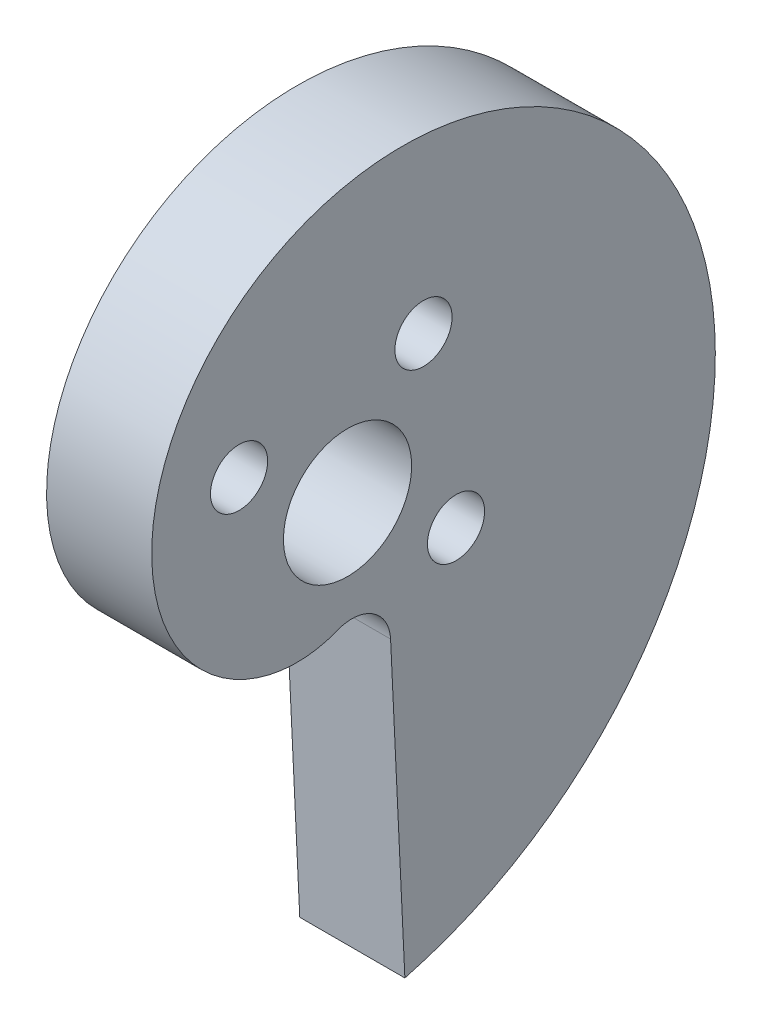
from build123d import *

# Parameters (mm, degrees)
SKETCH4_R              = 3
BOSS_EXTRUDE1_DEPTH    = 6.35
MOVE_FACE1_OUTLINE_R   = 3
MOVE_FACE1_OUTLINE_R_2 = 2.7841
MOVE_FACE1_DEPTH       = 6.35
SKETCH11_R             = 1.7272
SKETCH11_R_2           = 3.873
CUT_EXTRUDE2_DEPTH     = 36.237722546


# Read off the part's stored shape, not the designer's step: Move Face1
with BuildPart() as part:
    # Sketch4 → Boss-Extrude1 (new body)
    with BuildSketch(Plane(origin=(0, 0, 0), x_dir=(0, 0, -1), z_dir=(1, 0, 0))):
        with BuildLine():
            Line((3.667013126, -26.3254835), (2.816473307, -8.431236894))
            ThreePointArc((2.816473307, -8.431236894), (1.639602622, -6.396649217), (-0.700777066, -6.179406175))
            add(Edge.make_bspline(
                [(-0.700777066, -6.179406175), (-1.525102008, -6.512822326), (-2.494871997, -6.679047096), (-4.555429578, -6.54165034), (-5.644996058, -6.237076936), (-7.717261628, -5.106975392), (-8.698405735, -4.281093265), (-10.311829803, -2.164612563), (-10.942499326, -0.874358563), (-11.647480976, 2.006859472), (-11.720427957, 3.596803483), (-11.182779689, 6.826310345), (-10.571334953, 8.46432492), (-9.132019695, 10.73433891), (-8.566197708, 11.459621106), (-7.273120414, 12.810057002), (-6.545872807, 13.435152517), (-4.948692799, 14.549748502), (-4.078780417, 15.039192621), (-2.22269385, 15.85074605), (-1.236551533, 16.172803424), (0.818678144, 16.623204755), (1.887722789, 16.751503646), (4.069669804, 16.79483508), (5.182520117, 16.709831654), (7.408648574, 16.315055224), (8.521867273, 16.00525724), (10.70264063, 15.158359498), (11.770130786, 14.621247223), (13.812561896, 13.326727542), (14.787435905, 12.56932106), (16.598938448, 10.850935673), (17.435500393, 9.889971566), (18.927885533, 7.790674993), (19.583645356, 6.652371052), (20.677096627, 4.233429246), (21.114730733, 2.952832896), (21.741586229, 0.292117033), (21.930758945, -1.087949282), (22.038932986, -3.898444365), (21.957896657, -5.328810088), (21.513783431, -8.186144708), (21.150681858, -9.613043017), (20.141400668, -12.407098951), (19.49521083, -13.774181132), (17.930076055, -16.391877744), (17.011136269, -17.642414844), (14.922264044, -19.972214517), (13.752352434, -21.051401006), (11.194349378, -22.98792657), (9.80629411, -23.845193985), (6.855009859, -25.29377098), (5.291831431, -25.88501641), (3.667013126, -26.3254835)],
                knots=[0, 0, 0, 0, 0.0625, 0.0625, 0.125, 0.125, 0.1875, 0.1875, 0.25, 0.25, 0.3125, 0.3125, 0.375, 0.375, 0.40625, 0.40625, 0.4375, 0.4375, 0.46875, 0.46875, 0.5, 0.5, 0.53125, 0.53125, 0.5625, 0.5625, 0.59375, 0.59375, 0.625, 0.625, 0.65625, 0.65625, 0.6875, 0.6875, 0.71875, 0.71875, 0.75, 0.75, 0.78125, 0.78125, 0.8125, 0.8125, 0.84375, 0.84375, 0.875, 0.875, 0.90625, 0.90625, 0.9375, 0.9375, 0.96875, 0.96875, 1, 1, 1, 1], degree=3))
        make_face()
        Circle(SKETCH4_R, mode=Mode.SUBTRACT)
    extrude(amount=BOSS_EXTRUDE1_DEPTH)

    # Move Face1 outline → Move Face1 (add)
    # profile 1 of 2: a face of its own
    with BuildSketch(Plane.YZ):
        with BuildLine():
            Line((-8.441487365, -2.600816779), (-26.604178645, -3.464116168))
            add(Edge.make_bspline(
                [(-26.604178645, -3.464116168), (-26.599569003, -3.481120458), (-26.594959362, -3.498124748), (-26.59034972, -3.515129038), (-26.585740078, -3.532133328), (-26.581130437, -3.549137618), (-26.576520795, -3.566141908), (-26.571911153, -3.583146198), (-26.567301512, -3.600150488), (-26.56269187, -3.617154778), (-26.558082228, -3.634159068), (-26.553472587, -3.651163358), (-26.548862945, -3.668167648), (-26.544253303, -3.685171938), (-26.53927128, -3.703549889), (-26.538898899, -3.704923549), (-26.538526517, -3.70629721), (-26.538154136, -3.707670871), (-26.537781754, -3.709044531), (-26.537409373, -3.710418192), (-26.537036991, -3.711791852), (-26.53666461, -3.713165513), (-26.536292228, -3.714539173), (-26.535919847, -3.715912834), (-26.535547465, -3.717286495), (-26.535175084, -3.718660155), (-26.534802702, -3.720033816), (-26.53424413, -3.722094307), (-26.534059907, -3.722773916), (-26.533858021, -3.723518442), (-26.533727067, -3.724001851), (-26.533440048, -3.725060798), (-26.533340537, -3.725426825), (-26.533133021, -3.726192717), (-26.532893488, -3.727076218), (-26.532782162, -3.727485594), (-26.532537582, -3.728388165), (-26.532375797, -3.728983938), (-26.532180677, -3.729703197), (-26.531993743, -3.730392017), (-26.531617908, -3.731776793), (-26.531429971, -3.732469173), (-26.531242014, -3.733161545), (-26.531054038, -3.733853909), (-26.530866042, -3.734546265), (-26.530678027, -3.735238614), (-26.530489992, -3.735930954), (-26.530301938, -3.736623286), (-26.530113864, -3.73731561), (-26.529925771, -3.738007927), (-26.529737659, -3.738700235), (-26.529549527, -3.739392535), (-26.529361375, -3.740084828), (-26.528420519, -3.74354625), (-26.527667523, -3.74631526), (-26.526914215, -3.749084142), (-26.526160594, -3.751852897), (-26.525406663, -3.754621524), (-26.524652417, -3.757390023), (-26.523897864, -3.760158394), (-26.523142994, -3.762926638), (-26.522387816, -3.765694753), (-26.521632324, -3.768462741), (-26.520876522, -3.7712306), (-26.520120408, -3.773998332), (-26.519363982, -3.776765936), (-26.517093769, -3.785068362), (-26.515579047, -3.790602801), (-26.514063078, -3.796136728), (-26.512545864, -3.801670141), (-26.511027403, -3.807203041), (-26.509507697, -3.812735429), (-26.507986745, -3.818267302), (-26.506464548, -3.823798661), (-26.504941106, -3.829329506), (-26.503416418, -3.834859837), (-26.501890486, -3.840389653), (-26.500363309, -3.845918954), (-26.498834888, -3.85144774), (-26.494245891, -3.868032549), (-26.491181583, -3.879087027), (-26.488112299, -3.890139439), (-26.485038042, -3.901189785), (-26.481958812, -3.912238061), (-26.478874612, -3.923284266), (-26.475785441, -3.934328398), (-26.472691304, -3.945370453), (-26.4695922, -3.956410431), (-26.466488131, -3.967448328), (-26.463379099, -3.978484142), (-26.460265106, -3.989517871), (-26.457146153, -4.000549514), (-26.441526593, -4.055697279), (-26.428951609, -4.099782062), (-26.416297387, -4.143833272), (-26.403564026, -4.187850766), (-26.390751622, -4.2318344), (-26.377860278, -4.275784033), (-26.364890086, -4.31969952), (-26.351841151, -4.363580717), (-26.338713566, -4.407427483), (-26.325507433, -4.451239673), (-26.312222848, -4.495017144), (-26.298859911, -4.538759754), (-26.285418719, -4.582467358), (-26.217821979, -4.800829638), (-26.162494118, -4.974957082), (-26.105922065, -5.148512984), (-26.048112096, -5.321488181), (-25.989070491, -5.49387351), (-25.928803524, -5.665659807), (-25.867317478, -5.836837911), (-25.804618624, -6.007398657), (-25.740713246, -6.177332884), (-25.675607616, -6.346631428), (-25.609308015, -6.515285126), (-25.541820718, -6.683284815), (-25.473152005, -6.850621333), (-25.263620445, -7.350613883), (-25.119234857, -7.681244245), (-24.970181526, -8.009184855), (-24.816563128, -8.334008567), (-24.658405438, -8.656540908), (-24.495574442, -8.975326705), (-24.328540305, -9.291435032), (-24.157090549, -9.604622916), (-23.981161893, -9.914157206), (-23.801250109, -10.220890306), (-23.616969066, -10.524098117), (-23.428657045, -10.824036045), (-23.23626742, -11.120542818), (-22.843508974, -11.706612059), (-22.643142176, -11.996174333), (-22.438808393, -12.282198027), (-22.230723583, -12.56460565), (-22.018648797, -12.843459923), (-21.802917467, -13.118447754), (-21.583605212, -13.389644606), (-21.360601243, -13.657176078), (-21.134077845, -13.920797741), (-20.904199437, -14.180403567), (-20.670850853, -14.43621903), (-20.434249131, -14.687936687), (-20.194399706, -14.935644556), (-19.70838235, -15.42287054), (-19.462215458, -15.662397811), (-19.212931723, -15.897766285), (-18.960728671, -16.128991264), (-18.70539447, -16.355994955), (-18.447304202, -16.578625492), (-18.186499944, -16.796967202), (-17.922857209, -17.011060359), (-17.656599224, -17.220738444), (-17.387896766, -17.42596103), (-17.116588056, -17.626860373), (-16.842954408, -17.82323191), (-16.566974945, -18.015139117), (-16.010532784, -18.389907039), (-15.730066911, -18.572777232), (-15.447424653, -18.751061226), (-15.162746667, -18.924851219), (-14.875916093, -19.093949929), (-14.587276398, -19.258367365), (-14.296840097, -19.418183126), (-14.004513923, -19.573354608), (-13.710535007, -19.723805382), (-13.415054471, -19.869556513), (-13.117916757, -20.010637113), (-12.819417073, -20.146961011), (-12.519527346, -20.278558541), (-11.917189037, -20.532242336), (-11.614733643, -20.65433651), (-11.311086848, -20.771622769), (-11.006314451, -20.884236095), (-10.700430715, -20.991914806), (-10.39369458, -21.094796517), (-10.086097937, -21.192946197), (-9.777608438, -21.286263743), (-9.468444303, -21.374756831), (-9.158720169, -21.458492374), (-8.848328151, -21.537414262), (-8.537533287, -21.611545146), (-8.226317575, -21.68088471), (-7.603260387, -21.809981168), (-7.291409675, -21.869743076), (-6.979352707, -21.924681004), (-6.667077965, -21.974937355), (-6.354741362, -22.020247701), (-6.042483137, -22.060828702), (-5.730286129, -22.096726163), (-5.418195248, -22.127815836), (-5.10638259, -22.154172495), (-4.794917194, -22.175889882), (-4.483768614, -22.19285834), (-4.173135796, -22.205184806), (-3.863025065, -22.212847752), (-3.244042, -22.218898546), (-2.935160635, -22.217283683), (-2.627009812, -22.211051294), (-2.319535889, -22.200221076), (-2.012978585, -22.184764162), (-1.707390049, -22.164745089), (-1.402745405, -22.140231054), (-1.099140461, -22.111224435), (-0.796711927, -22.077727229), (-0.495491172, -22.03980106), (-0.195495425, -21.997498698), (0.103120125, -21.950796576), (0.400341286, -21.899765548), (0.991819558, -21.789077387), (1.28608355, -21.729419077), (1.578768432, -21.665496674), (1.869917455, -21.597302553), (2.159298453, -21.524877058), (2.446882891, -21.44828864), (2.732707168, -21.367584679), (3.016672969, -21.282790594), (3.298648908, -21.193943649), (3.578623787, -21.101102717), (3.85659217, -21.004314712), (4.132391722, -20.903599993), (4.406031128, -20.799020335), (4.948821205, -20.582201458), (5.217977174, -20.469959264), (5.484813738, -20.353954278), (5.749350964, -20.234161295), (6.01138819, -20.110681465), (6.270917632, -19.983580155), (6.527976619, -19.852885482), (6.782472092, -19.718646938), (7.034289441, -19.580933449), (7.283432367, -19.43979613), (7.529901875, -19.295274808), (7.77354503, -19.147434253), (8.014385292, -18.996321733), (8.490309508, -18.687660003), (8.725396651, -18.530106846), (8.957555599, -18.369412167), (9.186776625, -18.205547192), (9.412909718, -18.038656901), (9.635962414, -17.868799381), (9.855964095, -17.695988596), (10.072835585, -17.520295455), (10.286488685, -17.341812823), (10.496935081, -17.160582706), (10.704177349, -16.976639307), (10.908088748, -16.790084702), (11.108697582, -16.60095136), (11.503188846, -16.217665056), (11.697072069, -16.023508272), (11.887567215, -15.826919792), (12.074634411, -15.627883555), (12.258185431, -15.42656542), (12.438237852, -15.223014525), (12.614807781, -15.017239038), (12.787836646, -14.809325702), (12.957268738, -14.599380603), (13.123118176, -14.387438261), (13.285386007, -14.173530705), (13.443983714, -13.9577844), (13.598936774, -13.740220791), (13.901469825, -13.301617581), (14.049048428, -13.080575457), (14.192938252, -12.85786673), (14.333075884, -12.633504041), (14.469436513, -12.407648424), (14.602043246, -12.180340569), (14.730898025, -11.951592848), (14.855967044, -11.721500116), (14.977228845, -11.490169384), (15.094696526, -11.257631481), (15.208368824, -11.023920803), (15.318201343, -10.789171515), (15.424212302, -10.553400689), (15.62854924, -10.079983096), (15.726872378, -9.842336108), (15.821368333, -9.603809457), (15.911963677, -9.364456828), (15.998688398, -9.124410274), (16.081568069, -8.883704025), (16.160594519, -8.642364015), (16.235759672, -8.400484565), (16.307073362, -8.15816166), (16.374546973, -7.915427103), (16.438178826, -7.672322007), (16.497967314, -7.428970727), (16.553923089, -7.185393613), (16.658169192, -6.697950384), (16.706458163, -6.454088263), (16.750931294, -6.210116308), (16.791551227, -5.966156004), (16.828352164, -5.722265003), (16.861371473, -5.478483856), (16.89061727, -5.234873215), (16.916091026, -4.991505669), (16.937812625, -4.748444975), (16.955811803, -4.505744551), (16.970101403, -4.263463823), (16.98068149, -4.021672476), (16.987586075, -3.780425869), (16.994060031, -3.299148156), (16.993631026, -3.059123221), (16.989555385, -2.819737011), (16.981828074, -2.581119041), (16.97049256, -2.343310945), (16.955590155, -2.106340667), (16.937140606, -1.870268338), (16.91516095, -1.635166239), (16.889682937, -1.401088709), (16.860744509, -1.168076804), (16.828369507, -0.936186685), (16.792572797, -0.705489655), (16.753396921, -0.476025059), (16.668327332, -0.019684131), (16.622436928, 0.207187985), (16.573210516, 0.43274012), (16.520676595, 0.656845924), (16.464882551, 0.879479604), (16.405870334, 1.100624284), (16.3436718, 1.320223268), (16.278319602, 1.538208936), (16.209854217, 1.754538123), (16.138317988, 1.969182142), (16.063745228, 2.182090339), (15.986166539, 2.393194111), (15.905627626, 2.602469813), (15.738694717, 3.017250287), (15.652304686, 3.222753348), (15.563011722, 3.426348397), (15.470874943, 3.627923175), (15.375941264, 3.827466031), (15.27825116, 4.024968988), (15.177848129, 4.22038201), (15.074779017, 4.413646484), (14.969089842, 4.604731213), (14.860824208, 4.793618869), (14.750025822, 4.980266585), (14.6367404, 5.164613119), (14.521012434, 5.346648599), (14.284759964, 5.705997611), (14.164238936, 5.88331198), (14.041346931, 6.058244698), (13.916166576, 6.230707349), (13.788741729, 6.400699169), (13.659110682, 6.568218603), (13.527326668, 6.733225876), (13.393447683, 6.895675454), (13.257522548, 7.055547765), (13.11959423, 7.212834846), (12.979713874, 7.367503996), (12.837939646, 7.519506253), (12.694312503, 7.668841812), (12.403459758, 7.962101433), (12.256236093, 8.106028416), (12.107245062, 8.247230378), (11.956582639, 8.385649016), (11.804288588, 8.521291455), (11.65039943, 8.654160681), (11.494975113, 8.78422985), (11.338080513, 8.911469301), (11.179764974, 9.035870418), (11.020069941, 9.157432821), (10.859051406, 9.276135657), (10.696775757, 9.391945779), (10.53327979, 9.504870215), (10.348041361, 9.62863484), (10.327440973, 9.642341074), (10.306822731, 9.656001739), (10.286186731, 9.669616814), (10.265532905, 9.683186339), (10.244861188, 9.696710349), (10.224171615, 9.710188832), (10.203464367, 9.723621723), (10.182739741, 9.737008906), (10.161998068, 9.750350261), (10.141239561, 9.763645725), (10.12046411, 9.776895389), (10.099671, 9.79009961), (10.058046161, 9.81641871), (10.037217098, 9.829531834), (10.016371494, 9.842598537), (9.995509453, 9.855618821), (9.974631077, 9.868592692), (9.953736471, 9.881520152), (9.932825737, 9.894401206), (9.911898978, 9.907235857), (9.890956298, 9.920024109), (9.869997801, 9.932765967), (9.849023589, 9.945461434), (9.828033765, 9.958110514), (9.807028434, 9.97071321), (9.743966224, 10.00838216), (9.701863133, 10.033309276), (9.659699249, 10.058050905), (9.617475395, 10.082607077), (9.575192397, 10.106977826), (9.532851077, 10.131163181), (9.490452261, 10.155163174), (9.447996771, 10.178977836), (9.405485434, 10.202607198), (9.362919072, 10.226051291), (9.320298511, 10.249310147), (9.277624573, 10.272383796), (9.234898083, 10.29527227), (9.106563432, 10.363382261), (9.020800116, 10.408048353), (8.934836483, 10.451974125), (8.848679096, 10.495159823), (8.762334519, 10.537605698), (8.675809318, 10.579311995), (8.589110055, 10.620278965), (8.502243296, 10.660506853), (8.415215603, 10.699995909), (8.328033542, 10.73874638), (8.240703676, 10.776758515), (8.15323257, 10.814032561), (8.065626787, 10.850568766), (7.802425101, 10.957964605), (7.626444742, 11.026611369), (7.450004147, 11.092309662), (7.27315561, 11.155061426), (7.095951384, 11.214868552), (6.918443686, 11.271732888), (6.740684687, 11.325656229), (6.562726523, 11.376640328), (6.384621288, 11.424686885), (6.206421038, 11.469797554), (6.028177787, 11.511973941), (5.84994351, 11.551217606), (5.671770144, 11.587530057), (5.315649022, 11.654295458), (5.137728602, 11.684747226), (4.959700016, 11.712299475), (4.783019884, 11.736712222), (4.604276011, 11.758891306), (4.429464411, 11.777036031), (4.250811556, 11.793890793), (4.076436597, 11.806370641), (3.899761626, 11.817263639), (3.725133165, 11.824666119), (3.550410334, 11.829638498), (3.37648165, 11.831780195), (3.203155326, 11.831236863), (2.857881444, 11.824777298), (2.685930065, 11.818863209), (2.51470827, 11.810286856), (2.344260063, 11.799070213), (2.174629427, 11.785235191), (2.005860324, 11.768803637), (1.837996698, 11.749797331), (1.671082472, 11.728237989), (1.50516155, 11.704147262), (1.340277816, 11.677546737), (1.176475132, 11.648457935), (1.013797343, 11.616902313), (0.852288272, 11.582901263), (0.61184345, 11.528263534), (0.53200571, 11.509447542), (0.452431498, 11.490014724), (0.373262519, 11.470000825), (0.294382178, 11.449393041), (0.215797381, 11.428191413), (0.137577788, 11.406409742), (0.059709652, 11.384053465), (-0.017850954, 11.361120913), (-0.095072103, 11.33761765), (-0.171912733, 11.313553202), (-0.248433789, 11.288926884), (-0.324588602, 11.263745774), (-0.476187787, 11.21228181), (-0.551629997, 11.185999058), (-0.626711201, 11.159170067), (-0.701427774, 11.131799368), (-0.775776089, 11.103891494), (-0.849752523, 11.075450975), (-0.92335345, 11.046482344), (-0.996575245, 11.016990131), (-1.069414282, 10.986978867), (-1.141866938, 10.956453085), (-1.213929586, 10.925417316), (-1.285598602, 10.89387609), (-1.35687036, 10.86183394), (-1.569482988, 10.764218312), (-1.709621229, 10.697155476), (-1.848127108, 10.628143005), (-1.98497177, 10.557216936), (-2.120126347, 10.484413233), (-2.253561967, 10.409767786), (-2.385249746, 10.333316406), (-2.515160795, 10.255094835), (-2.643266216, 10.175138734), (-2.769537102, 10.093483694), (-2.893944539, 10.010165228), (-3.016459604, 9.925218776), (-3.137053367, 9.838679702), (-3.315018649, 9.706535092), (-3.373849905, 9.662101445), (-3.432225085, 9.617246491), (-3.489973308, 9.572127532), (-3.547384771, 9.52651408), (-3.604222119, 9.480589049), (-3.660493818, 9.43435795), (-3.716362737, 9.387700649), (-3.771715305, 9.340702599), (-3.826473613, 9.293429538), (-3.880830859, 9.245743042), (-3.934616774, 9.197770987), (-3.987913252, 9.149459099), (-4.093478067, 9.052199488), (-4.145749357, 9.003249721), (-4.19750826, 8.953985292), (-4.248753506, 8.904411497), (-4.299483825, 8.854533635), (-4.349697947, 8.804357003), (-4.399394603, 8.753886901), (-4.448572522, 8.703128624), (-4.497230434, 8.652087473), (-4.545367069, 8.600768744), (-4.592981158, 8.549177736), (-4.640071431, 8.497319746), (-4.686636617, 8.445200073), (-4.824753105, 8.288071896), (-4.914725275, 8.182294046), (-5.002581891, 8.075532644), (-5.088312844, 7.967829797), (-5.171907984, 7.859227538), (-5.253357116, 7.749767825), (-5.332650002, 7.639492543), (-5.409776362, 7.528443501), (-5.48472587, 7.416662437), (-5.55748816, 7.304191013), (-5.628052821, 7.191070818), (-5.696409398, 7.077343365), (-5.762547394, 6.963050096), (-5.890365144, 6.733414655), (-5.952053709, 6.61804774), (-6.011379226, 6.5024593), (-6.068789532, 6.385932229), (-6.123482319, 6.2698429), (-6.176476599, 6.152615371), (-6.226996856, 6.035513752), (-6.275228474, 5.918322644), (-6.321621575, 5.800380212), (-6.365473581, 5.682832438), (-6.407390636, 5.564799764), (-6.447052072, 5.446825396), (-6.484587524, 5.328765169), (-6.55536853, 5.092635858), (-6.588616961, 4.974562342), (-6.619731944, 4.856519728), (-6.64872202, 4.73854772), (-6.675595644, 4.620685966), (-6.700361191, 4.50297406), (-6.723026952, 4.385451536), (-6.743601132, 4.268157874), (-6.762091856, 4.151132495), (-6.778507164, 4.034414767), (-6.792855012, 3.918043998), (-6.805143275, 3.802059442), (-6.815379741, 3.686500296), (-6.839956872, 3.341216503), (-6.848154204, 3.113073347), (-6.848438469, 2.887099769), (-6.84084938, 2.663718746), (-6.825763132, 2.443005573), (-6.803253008, 2.225285636), (-6.773501282, 2.01082461), (-6.73678547, 1.799796855), (-6.69324338, 1.592468222), (-6.643018498, 1.389115017), (-6.586393416, 1.18991247), (-6.52346955, 0.995146747), (-6.454467342, 0.805035191), (-6.379554183, 0.619822851)],
                knots=[-0.001662915, -0.001662915, -0.001662915, -0.001662915, -0.001662915, -0.001662915, -0.001662915, -0.001662915, -0.001662915, -0.001662915, -0.001662915, -0.001662915, -0.001662915, -0.001662915, -0.001662915, -0.000136719, -0.000136719, -0.000136719, -0.000136719, -0.000136719, -0.000136719, -0.000136719, -0.000136719, -0.000136719, -0.000136719, -0.000136719, -0.000136719, -0.000136719, -1.3428e-05, -1.3428e-05, -1.3428e-05, -1.3428e-05, -1.3428e-05, -1.3428e-05, -1.3428e-05, -1.3428e-05, -1.3428e-05, -1.3428e-05, -1.3428e-05, -1.3428e-05, -1.3428e-05, 4.8218e-05, 4.8218e-05, 4.8218e-05, 4.8218e-05, 4.8218e-05, 4.8218e-05, 4.8218e-05, 4.8218e-05, 4.8218e-05, 4.8218e-05, 4.8218e-05, 4.8218e-05, 4.8218e-05, 0.000109863, 0.000109863, 0.000109863, 0.000109863, 0.000109863, 0.000109863, 0.000109863, 0.000109863, 0.000109863, 0.000109863, 0.000109863, 0.000109863, 0.000109863, 0.000356445, 0.000356445, 0.000356445, 0.000356445, 0.000356445, 0.000356445, 0.000356445, 0.000356445, 0.000356445, 0.000356445, 0.000356445, 0.000356445, 0.000356445, 0.000849609, 0.000849609, 0.000849609, 0.000849609, 0.000849609, 0.000849609, 0.000849609, 0.000849609, 0.000849609, 0.000849609, 0.000849609, 0.000849609, 0.000849609, 0.001835937, 0.001835937, 0.001835937, 0.001835937, 0.001835937, 0.001835937, 0.001835937, 0.001835937, 0.001835937, 0.001835937, 0.001835937, 0.001835937, 0.001835937, 0.00578125, 0.00578125, 0.00578125, 0.00578125, 0.00578125, 0.00578125, 0.00578125, 0.00578125, 0.00578125, 0.00578125, 0.00578125, 0.00578125, 0.00578125, 0.0215625, 0.0215625, 0.0215625, 0.0215625, 0.0215625, 0.0215625, 0.0215625, 0.0215625, 0.0215625, 0.0215625, 0.0215625, 0.0215625, 0.0215625, 0.053125, 0.053125, 0.053125, 0.053125, 0.053125, 0.053125, 0.053125, 0.053125, 0.053125, 0.053125, 0.053125, 0.053125, 0.053125, 0.0846875, 0.0846875, 0.0846875, 0.0846875, 0.0846875, 0.0846875, 0.0846875, 0.0846875, 0.0846875, 0.0846875, 0.0846875, 0.0846875, 0.0846875, 0.11625, 0.11625, 0.11625, 0.11625, 0.11625, 0.11625, 0.11625, 0.11625, 0.11625, 0.11625, 0.11625, 0.11625, 0.11625, 0.1478125, 0.1478125, 0.1478125, 0.1478125, 0.1478125, 0.1478125, 0.1478125, 0.1478125, 0.1478125, 0.1478125, 0.1478125, 0.1478125, 0.1478125, 0.179375, 0.179375, 0.179375, 0.179375, 0.179375, 0.179375, 0.179375, 0.179375, 0.179375, 0.179375, 0.179375, 0.179375, 0.179375, 0.2109375, 0.2109375, 0.2109375, 0.2109375, 0.2109375, 0.2109375, 0.2109375, 0.2109375, 0.2109375, 0.2109375, 0.2109375, 0.2109375, 0.2109375, 0.2425, 0.2425, 0.2425, 0.2425, 0.2425, 0.2425, 0.2425, 0.2425, 0.2425, 0.2425, 0.2425, 0.2425, 0.2425, 0.2740625, 0.2740625, 0.2740625, 0.2740625, 0.2740625, 0.2740625, 0.2740625, 0.2740625, 0.2740625, 0.2740625, 0.2740625, 0.2740625, 0.2740625, 0.305625, 0.305625, 0.305625, 0.305625, 0.305625, 0.305625, 0.305625, 0.305625, 0.305625, 0.305625, 0.305625, 0.305625, 0.305625, 0.3371875, 0.3371875, 0.3371875, 0.3371875, 0.3371875, 0.3371875, 0.3371875, 0.3371875, 0.3371875, 0.3371875, 0.3371875, 0.3371875, 0.3371875, 0.36875, 0.36875, 0.36875, 0.36875, 0.36875, 0.36875, 0.36875, 0.36875, 0.36875, 0.36875, 0.36875, 0.36875, 0.36875, 0.4003125, 0.4003125, 0.4003125, 0.4003125, 0.4003125, 0.4003125, 0.4003125, 0.4003125, 0.4003125, 0.4003125, 0.4003125, 0.4003125, 0.4003125, 0.431875, 0.431875, 0.431875, 0.431875, 0.431875, 0.431875, 0.431875, 0.431875, 0.431875, 0.431875, 0.431875, 0.431875, 0.431875, 0.4634375, 0.4634375, 0.4634375, 0.4634375, 0.4634375, 0.4634375, 0.4634375, 0.4634375, 0.4634375, 0.4634375, 0.4634375, 0.4634375, 0.4634375, 0.495, 0.495, 0.495, 0.495, 0.495, 0.495, 0.495, 0.495, 0.495, 0.495, 0.495, 0.495, 0.495, 0.5265625, 0.5265625, 0.5265625, 0.5265625, 0.5265625, 0.5265625, 0.5265625, 0.5265625, 0.5265625, 0.5265625, 0.5265625, 0.5265625, 0.5265625, 0.558125, 0.558125, 0.558125, 0.558125, 0.558125, 0.558125, 0.558125, 0.558125, 0.558125, 0.558125, 0.558125, 0.558125, 0.558125, 0.5896875, 0.5896875, 0.5896875, 0.5896875, 0.5896875, 0.5896875, 0.5896875, 0.5896875, 0.5896875, 0.5896875, 0.5896875, 0.5896875, 0.5896875, 0.62125, 0.62125, 0.62125, 0.62125, 0.62125, 0.62125, 0.62125, 0.62125, 0.62125, 0.62125, 0.62125, 0.62125, 0.62125, 0.625195313, 0.625195313, 0.625195313, 0.625195313, 0.625195313, 0.625195313, 0.625195313, 0.625195313, 0.625195313, 0.625195313, 0.625195313, 0.625195313, 0.625195313, 0.629140625, 0.629140625, 0.629140625, 0.629140625, 0.629140625, 0.629140625, 0.629140625, 0.629140625, 0.629140625, 0.629140625, 0.629140625, 0.629140625, 0.629140625, 0.63703125, 0.63703125, 0.63703125, 0.63703125, 0.63703125, 0.63703125, 0.63703125, 0.63703125, 0.63703125, 0.63703125, 0.63703125, 0.63703125, 0.63703125, 0.6528125, 0.6528125, 0.6528125, 0.6528125, 0.6528125, 0.6528125, 0.6528125, 0.6528125, 0.6528125, 0.6528125, 0.6528125, 0.6528125, 0.6528125, 0.684375, 0.684375, 0.684375, 0.684375, 0.684375, 0.684375, 0.684375, 0.684375, 0.684375, 0.684375, 0.684375, 0.684375, 0.684375, 0.7159375, 0.7159375, 0.7159375, 0.7159375, 0.7159375, 0.7159375, 0.7159375, 0.7159375, 0.7159375, 0.7159375, 0.7159375, 0.7159375, 0.7159375, 0.7475, 0.7475, 0.7475, 0.7475, 0.7475, 0.7475, 0.7475, 0.7475, 0.7475, 0.7475, 0.7475, 0.7475, 0.7475, 0.76328125, 0.76328125, 0.76328125, 0.76328125, 0.76328125, 0.76328125, 0.76328125, 0.76328125, 0.76328125, 0.76328125, 0.76328125, 0.76328125, 0.76328125, 0.7790625, 0.7790625, 0.7790625, 0.7790625, 0.7790625, 0.7790625, 0.7790625, 0.7790625, 0.7790625, 0.7790625, 0.7790625, 0.7790625, 0.7790625, 0.810625, 0.810625, 0.810625, 0.810625, 0.810625, 0.810625, 0.810625, 0.810625, 0.810625, 0.810625, 0.810625, 0.810625, 0.810625, 0.82640625, 0.82640625, 0.82640625, 0.82640625, 0.82640625, 0.82640625, 0.82640625, 0.82640625, 0.82640625, 0.82640625, 0.82640625, 0.82640625, 0.82640625, 0.8421875, 0.8421875, 0.8421875, 0.8421875, 0.8421875, 0.8421875, 0.8421875, 0.8421875, 0.8421875, 0.8421875, 0.8421875, 0.8421875, 0.8421875, 0.87375, 0.87375, 0.87375, 0.87375, 0.87375, 0.87375, 0.87375, 0.87375, 0.87375, 0.87375, 0.87375, 0.87375, 0.87375, 0.9053125, 0.9053125, 0.9053125, 0.9053125, 0.9053125, 0.9053125, 0.9053125, 0.9053125, 0.9053125, 0.9053125, 0.9053125, 0.9053125, 0.9053125, 0.936875, 0.936875, 0.936875, 0.936875, 0.936875, 0.936875, 0.936875, 0.936875, 0.936875, 0.936875, 0.936875, 0.936875, 0.936875, 1, 1, 1, 1, 1, 1, 1, 1, 1, 1, 1, 1, 1, 1, 1], degree=14))
            ThreePointArc((-6.379554183, 0.619822851), (-6.578477057, -1.52319194), (-8.441487365, -2.600816779))
        make_face()
        with BuildLine():
            add(Edge.make_bspline(
                [(-26.3254835, -3.667013126), (-25.88501641, -5.291831431), (-25.29377098, -6.855009859), (-23.845193985, -9.80629411), (-22.98792657, -11.194349378), (-21.051401006, -13.752352434), (-19.972214517, -14.922264044), (-17.642414844, -17.011136269), (-16.391877744, -17.930076055), (-13.774181132, -19.49521083), (-12.407098951, -20.141400668), (-9.613043017, -21.150681858), (-8.186144708, -21.513783431), (-5.328810088, -21.957896657), (-3.898444365, -22.038932986), (-1.087949282, -21.930758945), (0.292117033, -21.741586229), (2.952832896, -21.114730733), (4.233429246, -20.677096627), (6.652371052, -19.583645356), (7.790674993, -18.927885533), (9.889971566, -17.435500393), (10.850935673, -16.598938448), (12.56932106, -14.787435905), (13.326727542, -13.812561896), (14.621247223, -11.770130786), (15.158359498, -10.70264063), (16.00525724, -8.521867273), (16.315055224, -7.408648574), (16.709831654, -5.182520117), (16.79483508, -4.069669804), (16.751503646, -1.887722789), (16.623204755, -0.818678144), (16.172803424, 1.236551533), (15.85074605, 2.22269385), (15.039192621, 4.078780417), (14.549748502, 4.948692799), (13.435152517, 6.545872807), (12.810057002, 7.273120414), (11.459621106, 8.566197708), (10.73433891, 9.132019695), (8.46432492, 10.571334953), (6.826310345, 11.182779689), (3.596803483, 11.720427957), (2.006859472, 11.647480976), (-0.874358563, 10.942499326), (-2.164612563, 10.311829803), (-4.281093265, 8.698405735), (-5.106975392, 7.717261628), (-6.237076936, 5.644996058), (-6.54165034, 4.555429578), (-6.679047096, 2.494871997), (-6.512822326, 1.525102008), (-6.179406175, 0.700777066)],
                knots=[0, 0, 0, 0, 0.03125, 0.03125, 0.0625, 0.0625, 0.09375, 0.09375, 0.125, 0.125, 0.15625, 0.15625, 0.1875, 0.1875, 0.21875, 0.21875, 0.25, 0.25, 0.28125, 0.28125, 0.3125, 0.3125, 0.34375, 0.34375, 0.375, 0.375, 0.40625, 0.40625, 0.4375, 0.4375, 0.46875, 0.46875, 0.5, 0.5, 0.53125, 0.53125, 0.5625, 0.5625, 0.59375, 0.59375, 0.625, 0.625, 0.6875, 0.6875, 0.75, 0.75, 0.8125, 0.8125, 0.875, 0.875, 0.9375, 0.9375, 1, 1, 1, 1], degree=3))
            Line((-26.3254835, -3.667013126), (-8.431236894, -2.816473307))
            ThreePointArc((-8.431236894, -2.816473307), (-6.396649217, -1.639602622), (-6.179406175, 0.700777066))
        make_face(mode=Mode.SUBTRACT)
    # profile 2 of 2: a face of its own
    with BuildSketch(Plane.YZ):
        Circle(MOVE_FACE1_OUTLINE_R)
        Circle(MOVE_FACE1_OUTLINE_R_2, mode=Mode.SUBTRACT)
    extrude(amount=MOVE_FACE1_DEPTH)

    # Sketch11 → Cut-Extrude2 (cut, through all)
    with BuildSketch(Plane.ZY):
        with Locations((-6.553216354, -4.588611491)):
            Circle(SKETCH11_R)
        with Locations((-4.588611491, 6.553216354)):
            Circle(SKETCH11_R)
        with Locations((6.553216354, 4.588611491)):
            Circle(SKETCH11_R)
        Circle(SKETCH11_R_2)
    extrude(amount=-CUT_EXTRUDE2_DEPTH, mode=Mode.SUBTRACT)


solid = part.part
